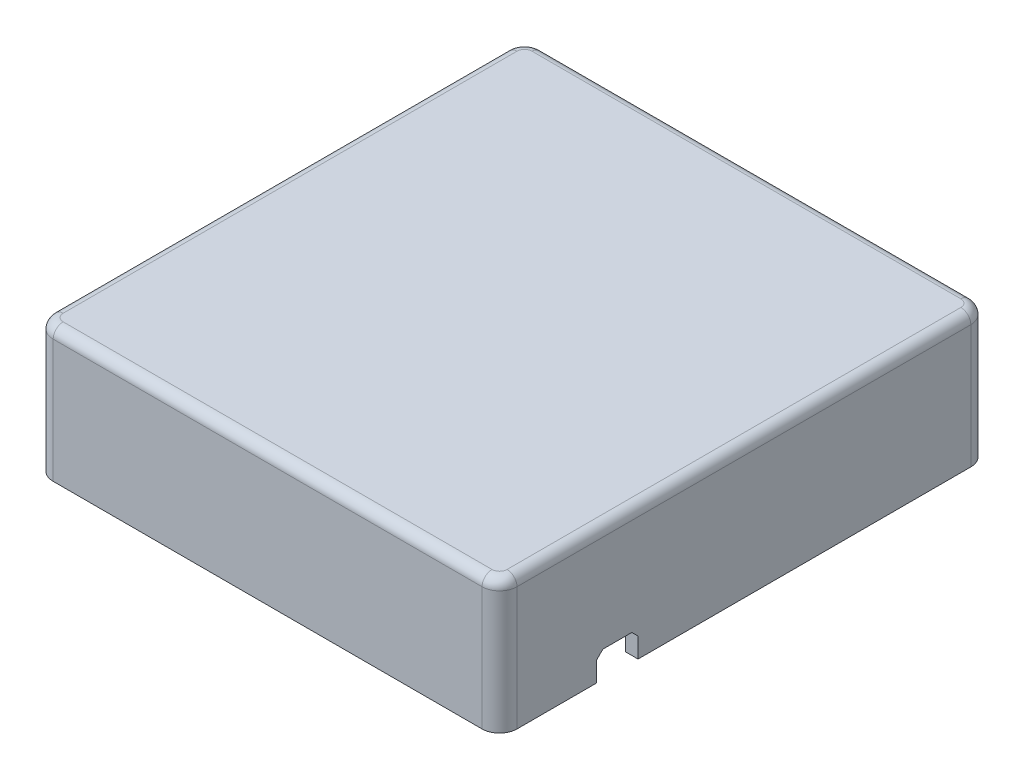
from build123d import *

# Parameters (mm, degrees)
SKETCH1_W           = 186
SKETCH1_H           = 196
BOSS_EXTRUDE1_DEPTH = 3
BOSS_EXTRUDE2_START = -53.4
BOSS_EXTRUDE2_DEPTH = 50.4
CHAMFER1_SIZE       = 10
SKETCH1_4_W         = 5
SKETCH1_4_H         = 0.8
SKETCH1_4_H_2       = 15
BOSS_EXTRUDE3_DEPTH = 42.9
CHAMFER2_SIZE       = 2.5
SKETCH2_R           = 2.35
SKETCH2_R_2         = 1.8
CUT_EXTRUDE2_DEPTH  = 4.5
SKETCH2_3_R         = 1.8
CUT_EXTRUDE3_DEPTH  = 8
FILLET1_R           = 7
FILLET2_R           = 4


with BuildPart() as part:
    # Sketch1 → Boss-Extrude1 (new body)
    with BuildSketch(Plane(origin=(0, 0, 0), x_dir=(1, 0, 0), z_dir=(0, 1, 0))):
        with Locations((93, 98)):
            Rectangle(SKETCH1_W, SKETCH1_H)
    extrude(amount=-BOSS_EXTRUDE1_DEPTH)

    # Sketch1<3> → Boss-Extrude2 (add)
    with BuildSketch(Plane(origin=(0, 0, 0), x_dir=(1, 0, 0), z_dir=(0, 1, 0)).offset(BOSS_EXTRUDE2_START)):
        Polygon((186, 196), (158.2, 196), (158.2, 191), (181, 191), (181, 55.55), (186, 55.55), align=None)
        Polygon((81.6, 191), (81.6, 196), (0, 196), (0, 0), (186, 0), (186, 38.95), (181, 38.95), (181, 5), (5, 5), (5, 191), align=None)
    extrude(amount=BOSS_EXTRUDE2_DEPTH)

    # Chamfer1
    chamfer1_edges = [part.edges().sort_by_distance(p)[0] for p in [
        (5, -28.2, -191),
        (5, -28.2, -5),
        (181, -28.2, -5),
        (181, -28.2, -191),
    ]]
    chamfer(chamfer1_edges, length=CHAMFER1_SIZE)

    # Sketch1<4> → Boss-Extrude3 (add)
    with BuildSketch(Plane(origin=(0, 0, 0), x_dir=(1, 0, 0), z_dir=(0, 1, 0))):
        with Locations((183.5, 55.15)):
            Rectangle(SKETCH1_4_W, SKETCH1_4_H)
        with Locations((183.5, 47.25)):
            Rectangle(SKETCH1_4_W, SKETCH1_4_H_2)
        with Locations((183.5, 39.35)):
            Rectangle(SKETCH1_4_W, SKETCH1_4_H)
    extrude(amount=-BOSS_EXTRUDE3_DEPTH)

    # Chamfer2
    chamfer2_edges = [part.edges().sort_by_distance(p)[0] for p in [
        (183.5, -42.9, -55.55),
        (183.5, -42.9, -38.95),
    ]]
    chamfer(chamfer2_edges, length=CHAMFER2_SIZE)

    # Sketch2 → Cut-Extrude2 (cut)
    # profile 1 of 4: a face of its own
    with BuildSketch(Plane.XZ.offset(53.4)):
        with Locations(Location((6.5, -6.5, 0), (0, 0, 270))):
            Circle(SKETCH2_R)
        with Locations(Location((6.5, -6.5, 0), (0, 0, 270))):
            Circle(SKETCH2_R_2, mode=Mode.SUBTRACT)
    # profile 2 of 4: a face of its own
    with BuildSketch(Plane.XZ.offset(53.4)):
        with Locations(Location((179.5, -6.5, 0), (0, 0, 90))):
            Circle(SKETCH2_R)
        with Locations(Location((179.5, -6.5, 0), (0, 0, 90))):
            Circle(SKETCH2_R_2, mode=Mode.SUBTRACT)
    # profile 3 of 4: a face of its own
    with BuildSketch(Plane.XZ.offset(53.4)):
        with Locations(Location((179.5, -189.5, 0), (0, 0, 270))):
            Circle(SKETCH2_R)
        with Locations(Location((179.5, -189.5, 0), (0, 0, 270))):
            Circle(SKETCH2_R_2, mode=Mode.SUBTRACT)
    # profile 4 of 4: a face of its own
    with BuildSketch(Plane.XZ.offset(53.4)):
        with Locations(Location((6.5, -189.5, 0), (0, 0, 90))):
            Circle(SKETCH2_R)
        with Locations(Location((6.5, -189.5, 0), (0, 0, 90))):
            Circle(SKETCH2_R_2, mode=Mode.SUBTRACT)
    extrude(amount=-CUT_EXTRUDE2_DEPTH, mode=Mode.SUBTRACT)

    # Sketch2<3> → Cut-Extrude3 (cut)
    with BuildSketch(Plane.XZ.offset(53.4)):
        with Locations(Location((6.5, -6.5, 0), (0, 0, 270))):
            Circle(SKETCH2_3_R)
        with Locations(Location((6.5, -189.5, 0), (0, 0, 270))):
            Circle(SKETCH2_3_R)
        with Locations(Location((179.5, -189.5, 0), (0, 0, 270))):
            Circle(SKETCH2_3_R)
        with Locations(Location((179.5, -6.5, 0), (0, 0, 90))):
            Circle(SKETCH2_3_R)
    extrude(amount=-CUT_EXTRUDE3_DEPTH, mode=Mode.SUBTRACT)

    # Fillet1
    fillet1_edges = [part.edges().sort_by_distance(p)[0] for p in [
        (0, -26.7, 0),
        (186, -26.7, 0),
        (186, -26.7, -196),
        (0, -26.7, -196),
    ]]
    fillet(fillet1_edges, radius=FILLET1_R)

    # Fillet2
    # the kernel refuses this fillet: 4 mm, written as the material it takes off along each edge
    with BuildSketch(Plane(origin=(179, 0, -7), x_dir=(0, 0, 1), z_dir=(-1, 0, 0))) as fillet2_piece_1:
        with BuildLine():
            CenterArc((7 - FILLET2_R, -FILLET2_R), FILLET2_R, 0, 90)
            Line((7, -FILLET2_R), (7, 0))
            Line((7, 0), (7 - FILLET2_R, 0))
        make_face()
    revolve(axis=Axis((179, 0, -7), (0, 1, 0)), revolution_arc=90, mode=Mode.SUBTRACT)
    with BuildSketch(Plane(origin=(7, 0, 0), x_dir=(0, 0, -1), z_dir=(1, 0, 0))) as fillet2_piece_2:
        with BuildLine():
            CenterArc((FILLET2_R, -FILLET2_R), FILLET2_R, 90, 90)
            Line((0, -FILLET2_R), (0, 0))
            Line((0, 0), (FILLET2_R, 0))
        make_face()
    extrude(amount=172, mode=Mode.SUBTRACT)
    with BuildSketch(Plane(origin=(7, 0, -7), x_dir=(0, 0, 1), z_dir=(1, 0, 0))) as fillet2_piece_3:
        with BuildLine():
            CenterArc((7 - FILLET2_R, FILLET2_R), FILLET2_R, 270, 90)
            Line((7, FILLET2_R), (7, 0))
            Line((7, 0), (7 - FILLET2_R, 0))
        make_face()
    revolve(axis=Axis((7, 0, -7), (0, -1, 0)), revolution_arc=90, mode=Mode.SUBTRACT)
    with BuildSketch(Plane(origin=(0, 0, -189), x_dir=(1, 0, 0), z_dir=(0, 0, 1))) as fillet2_piece_4:
        with BuildLine():
            CenterArc((FILLET2_R, -FILLET2_R), FILLET2_R, 90, 90)
            Line((0, -FILLET2_R), (0, 0))
            Line((0, 0), (FILLET2_R, 0))
        make_face()
    extrude(amount=182, mode=Mode.SUBTRACT)
    with BuildSketch(Plane(origin=(7, 0, -189), x_dir=(0, 0, -1), z_dir=(1, 0, 0))) as fillet2_piece_5:
        with BuildLine():
            CenterArc((7 - FILLET2_R, -FILLET2_R), FILLET2_R, 0, 90)
            Line((7, -FILLET2_R), (7, 0))
            Line((7, 0), (7 - FILLET2_R, 0))
        make_face()
    revolve(axis=Axis((7, 0, -189), (0, 1, 0)), revolution_arc=90, mode=Mode.SUBTRACT)
    with BuildSketch(Plane(origin=(179, 0, -196), x_dir=(0, -1, 0), z_dir=(-1, 0, 0))) as fillet2_piece_6:
        with BuildLine():
            CenterArc((FILLET2_R, FILLET2_R), FILLET2_R, 180, 90)
            Line((0, FILLET2_R), (0, 0))
            Line((0, 0), (FILLET2_R, 0))
        make_face()
    extrude(amount=172, mode=Mode.SUBTRACT)
    with BuildSketch(Plane(origin=(179, 0, -189), x_dir=(0, 0, -1), z_dir=(-1, 0, 0))) as fillet2_piece_7:
        with BuildLine():
            CenterArc((7 - FILLET2_R, FILLET2_R), FILLET2_R, 270, 90)
            Line((7 - FILLET2_R, 0), (7, 0))
            Line((7, 0), (7, FILLET2_R))
        make_face()
    revolve(axis=Axis((179, 0, -189), (0, -1, 0)), revolution_arc=90, mode=Mode.SUBTRACT)
    with BuildSketch(Plane(origin=(186, 0, -189), x_dir=(-1, 0, 0), z_dir=(0, 0, 1))) as fillet2_piece_8:
        with BuildLine():
            CenterArc((FILLET2_R, FILLET2_R), FILLET2_R, 180, 90)
            Line((0, FILLET2_R), (0, 0))
            Line((0, 0), (FILLET2_R, 0))
        make_face()
    extrude(amount=182, mode=Mode.SUBTRACT)


solid = part.part
